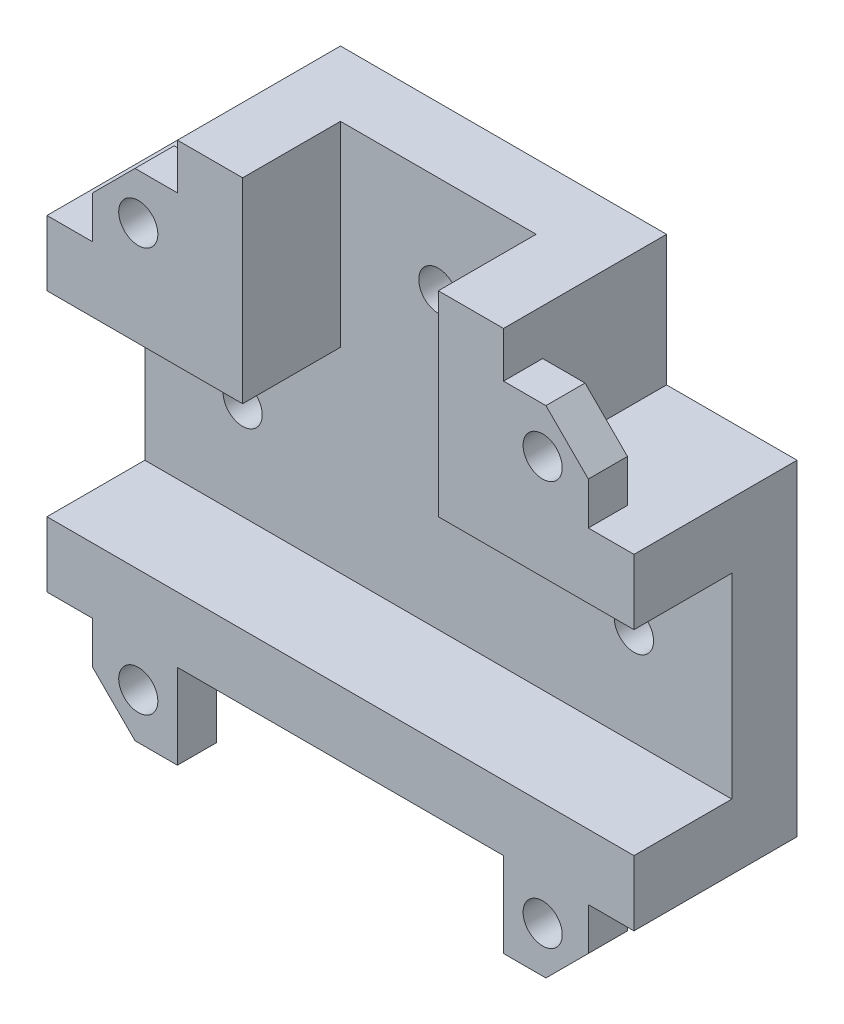
from build123d import *

# Parameters (mm, degrees)
BOSS_EXTRUDE1_DEPTH      = 5
BOSS_EXTRUDE2_DEPTH      = 12.5
SKETCH4_W                = 45
SKETCH4_H                = 5
BOSS_EXTRUDE3_DEPTH      = 12.5
BOSS_EXTRUDE5_DEPTH      = 3
SKETCH14_R               = 1.5
CUT_EXTRUDE2_DEPTH       = 38.23806379
SKETCH6_R                = 1.5
CUT_EXTRUDE3_DEPTH       = 36.870229925
MIRROR_1_COPY_1_DEPTH    = 3
MIRROR_1_COPY_2_SKETCH_R = 1.5
MIRROR_1_COPY_2_DEPTH    = 38.23806379


with BuildPart() as part:
    # Sketch1 → Boss-Extrude1 (new body)
    with BuildSketch(Plane.XY):
        Polygon((14.31372549, 0.735294118), (29.31372549, 0.735294118), (29.31372549, -14.264705882), (-15.68627451, -14.264705882), (-15.68627451, 0.735294118), (-0.68627451, 0.735294118), (-0.68627451, 15.735294118), (14.31372549, 15.735294118), align=None)
    extrude(amount=BOSS_EXTRUDE1_DEPTH)

    # Sketch2 → Boss-Extrude2 (add)
    with BuildSketch(Plane(origin=(0, 0, 0), x_dir=(-1, 0, 0), z_dir=(0, 0, -1))):
        Polygon((0.68627451, 15.735294118), (5.68627451, 15.735294118), (5.68627451, 5.735294118), (6.079970528, 5.735294118), (15.68627451, 5.735294118), (15.68627451, 0.735294118), (0.68627451, 0.735294118), align=None)
    boss_extrude2 = extrude(amount=-BOSS_EXTRUDE2_DEPTH)

    # Sketch4 → Boss-Extrude3 (add)
    with BuildSketch(Plane(origin=(0, 0, 0), x_dir=(-1, 0, 0), z_dir=(0, 0, -1))):
        with Locations((-6.81372549, -16.764705882)):
            Rectangle(SKETCH4_W, SKETCH4_H)
    extrude(amount=-BOSS_EXTRUDE3_DEPTH)

    # Mirror1: Boss-Extrude2 across plane
    add(boss_extrude2.mirror(Plane.ZY.offset(-6.81372549)))

    # Sketch13 → Boss-Extrude5 (add)
    with BuildSketch(Plane.XY.offset(12.5)):
        Polygon((-8.93627451, 12.235294118), (-12.18627451, 8.985294118), (-12.18627451, 5.735294118), (-5.68627451, 5.735294118), (-5.68627451, 12.235294118), align=None)
    boss_extrude5 = extrude(amount=-BOSS_EXTRUDE5_DEPTH)

    # Sketch14 → Cut-Extrude2 (cut, through all)
    with BuildSketch(Plane.XY.offset(12.5)):
        with Locations((-8.68627451, 8.735294118)):
            Circle(SKETCH14_R)
    cut_extrude2 = extrude(amount=-CUT_EXTRUDE2_DEPTH, mode=Mode.SUBTRACT)

    # Mirror9: Boss-Extrude5, Cut-Extrude2 across plane
    add(boss_extrude5.mirror(Plane.ZY.offset(-6.81372549)))
    add(cut_extrude2.mirror(Plane.ZY.offset(-6.81372549)), mode=Mode.SUBTRACT)

    # Sketch6 → Cut-Extrude3 (cut, through all)
    with BuildSketch(Plane.XY.offset(5)):
        with Locations((6.81372549, 8.235294118)):
            Circle(SKETCH6_R)
        with Locations((-8.18627451, -6.764705882)):
            Circle(SKETCH6_R)
        with Locations((21.81372549, -6.764705882)):
            Circle(SKETCH6_R)
    extrude(amount=-CUT_EXTRUDE3_DEPTH, mode=Mode.SUBTRACT)

    # 镜向1: Boss-Extrude5, Cut-Extrude2 across plane
    add(boss_extrude5.mirror(Plane.ZX.offset(-6.764705882)))
    add(cut_extrude2.mirror(Plane.ZX.offset(-6.764705882)), mode=Mode.SUBTRACT)

    # 镜向1 copy 1 sketch → 镜向1 copy 1 (add)
    with BuildSketch(Plane(origin=(13.62745098, -13.529411765, 12.5), x_dir=(-1, 0, 0), z_dir=(0, 0, 1))):
        Polygon((-8.93627451, 12.235294118), (-12.18627451, 8.985294118), (-12.18627451, 5.735294118), (-5.68627451, 5.735294118), (-5.68627451, 12.235294118), align=None)
    extrude(amount=-MIRROR_1_COPY_1_DEPTH)

    # 镜向1 copy 2 sketch → 镜向1 copy 2 (cut, through all)
    with BuildSketch(Plane(origin=(13.62745098, -13.529411765, 12.5), x_dir=(-1, 0, 0), z_dir=(0, 0, 1))):
        with Locations((-8.68627451, 8.735294118)):
            Circle(MIRROR_1_COPY_2_SKETCH_R)
    extrude(amount=-MIRROR_1_COPY_2_DEPTH, mode=Mode.SUBTRACT)


solid = part.part
